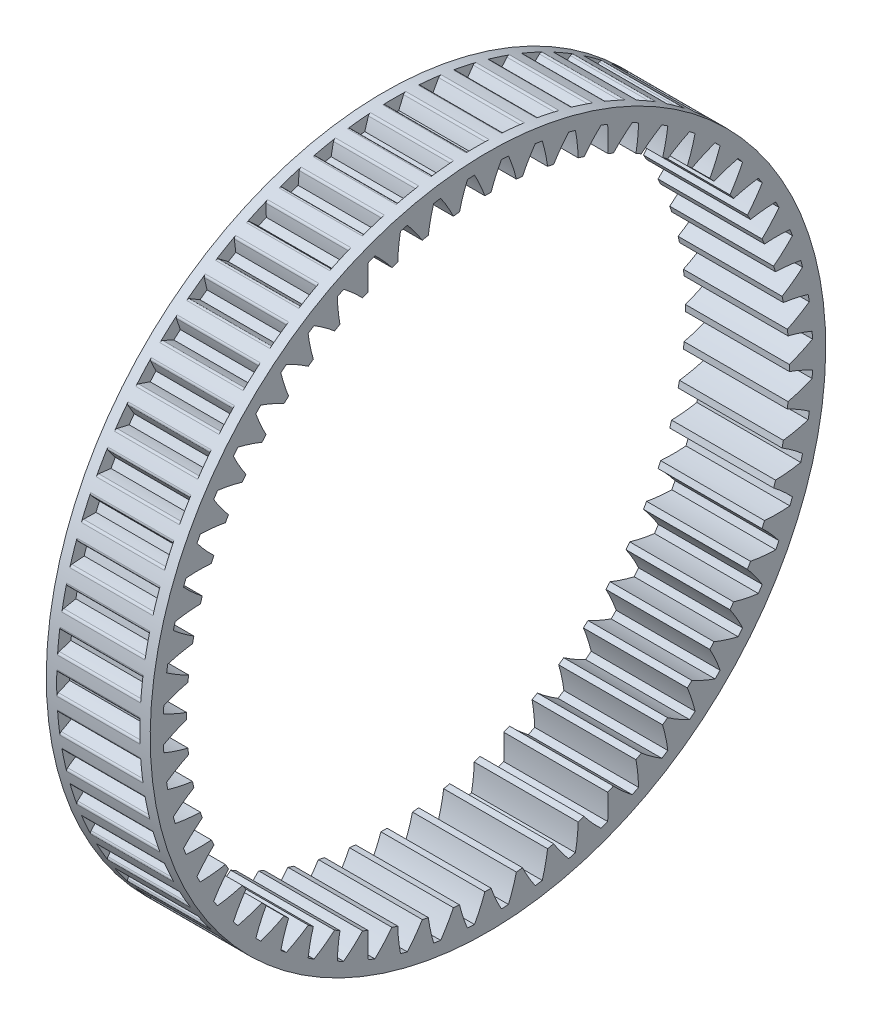
from build123d import *

# Parameters (mm, degrees)
SKETCH1_R                = 32.5
BOSS_EXTRUDE1_DEPTH      = 10
BODY_MOVE_COPY1_ANGLE    = 3
CUT_EXTRUDE1_START       = -1
CUT_EXTRUDE1_DEPTH       = 8
FILLET1_R                = 0.25
CIRPATTERN1_COUNT        = 60
FILLET1_OF_CIRPATTERN1_R = 0.25


with BuildPart() as part:
    # Sketch1 → Boss-Extrude1 (new body)
    with BuildSketch(Plane(origin=(10, 0, 0), x_dir=(0, 0, -1), z_dir=(1, 0, 0))):
        with Locations(Location((0, 0, 0), (0, 0, 180))):
            Circle(SKETCH1_R)
        with BuildLine():
            ThreePointArc((1.815562727, 28.943111996), (2.327964144, 30.050951132), (2.928742966, 31.113461165))
            ThreePointArc((2.928742966, 31.113461165), (3.266619006, 31.079803752), (3.604109412, 31.042477291))
            ThreePointArc((3.604109412, 31.042477291), (3.970851519, 29.878276711), (4.241723027, 28.688112273))
            ThreePointArc((4.241723027, 28.688112273), (4.536599486, 28.642961877), (4.830995903, 28.594780618))
            ThreePointArc((4.830995903, 28.594780618), (5.456391054, 29.642990363), (6.164941289, 30.636881367))
            ThreePointArc((6.164941289, 30.636881367), (6.49744825, 30.568090671), (6.829188171, 30.495691334))
            ThreePointArc((6.829188171, 30.495691334), (7.072229128, 29.299533377), (7.217210715, 28.087575002))
            ThreePointArc((7.217210715, 28.087575002), (7.505752308, 28.011848962), (7.793499678, 27.93315884))
            ThreePointArc((7.793499678, 27.93315884), (8.525036602, 28.910254788), (9.333595224, 29.824637486))
            ThreePointArc((9.333595224, 29.824637486), (9.657090091, 29.721467191), (9.979444915, 29.614788201))
            ThreePointArc((9.979444915, 29.614788201), (10.096121916, 28.399778225), (10.113625131, 27.179304382))
            ThreePointArc((10.113625131, 27.179304382), (10.392670537, 27.073832368), (10.670616239, 26.965495528))
            ThreePointArc((10.670616239, 26.965495528), (11.500280065, 27.860772412), (12.399988336, 28.685628636))
            ThreePointArc((12.399988336, 28.685628636), (12.710926833, 28.549209097), (13.020364772, 28.409419251))
            ThreePointArc((13.020364772, 28.409419251), (13.009399479, 27.18886916), (12.899232554, 25.973251616))
            ThreePointArc((12.899232554, 25.973251616), (13.165724492, 25.839189201), (13.430823295, 25.702392605))
            ThreePointArc((13.430823295, 25.702392605), (14.349524053, 26.506041583), (15.330524582, 27.232334036))
            ThreePointArc((15.330524582, 27.232334036), (15.6255, 27.064159894), (15.918630788, 26.892790759))
            ThreePointArc((15.918630788, 26.892790759), (15.780143338, 25.680073154), (15.543513286, 24.48263047))
            ThreePointArc((15.543513286, 24.48263047), (15.794532015, 24.32144647), (16.043879441, 24.157688889))
            ThreePointArc((16.043879441, 24.157688889), (17.041551653, 24.860905016), (18.093096392, 25.480676285))
            ThreePointArc((18.093096392, 25.480676285), (18.368876919, 25.282590091), (18.642488954, 25.081519224))
            ThreePointArc((18.642488954, 25.081519224), (18.377996645, 23.889920893), (18.017496034, 22.723772501))
            ThreePointArc((18.017496034, 22.723772501), (18.25029134, 22.537232882), (18.481155487, 22.348308479))
            ThreePointArc((18.481155487, 22.348308479), (19.546868447, 22.943387171), (20.657436452, 23.449846912))
            ThreePointArc((20.657436452, 23.449846912), (20.911000579, 23.224018941), (21.16209611, 22.995449316))
            ThreePointArc((21.16209611, 22.995449316), (20.774496775, 21.83802566), (20.294075324, 20.715948125))
            ThreePointArc((20.294075324, 20.715948125), (20.506096654, 20.506096654), (20.715948125, 20.294075324))
            ThreePointArc((20.715948125, 20.294075324), (21.83802566, 20.774496775), (22.995449316, 21.16209611))
            ThreePointArc((22.995449316, 21.16209611), (23.224018941, 20.911000579), (23.449846912, 20.657436452))
            ThreePointArc((23.449846912, 20.657436452), (22.943387171, 19.546868447), (22.348308479, 18.481155487))
            ThreePointArc((22.348308479, 18.481155487), (22.537232882, 18.25029134), (22.723772501, 18.017496034))
            ThreePointArc((22.723772501, 18.017496034), (23.889920893, 18.377996645), (25.081519224, 18.642488954))
            ThreePointArc((25.081519224, 18.642488954), (25.282590091, 18.368876919), (25.480676285, 18.093096392))
            ThreePointArc((25.480676285, 18.093096392), (24.860905016, 17.041551653), (24.157688889, 16.043879441))
            ThreePointArc((24.157688889, 16.043879441), (24.32144647, 15.794532015), (24.48263047, 15.543513286))
            ThreePointArc((24.48263047, 15.543513286), (25.680073154, 15.780143338), (26.892790759, 15.918630788))
            ThreePointArc((26.892790759, 15.918630788), (27.064159894, 15.6255), (27.232334036, 15.330524582))
            ThreePointArc((27.232334036, 15.330524582), (26.506041583, 14.349524053), (25.702392605, 13.430823295))
            ThreePointArc((25.702392605, 13.430823295), (25.839189201, 13.165724492), (25.973251616, 12.899232554))
            ThreePointArc((25.973251616, 12.899232554), (27.18886916, 13.009399479), (28.409419251, 13.020364772))
            ThreePointArc((28.409419251, 13.020364772), (28.549209097, 12.710926833), (28.685628636, 12.399988336))
            ThreePointArc((28.685628636, 12.399988336), (27.860772412, 11.500280065), (26.965495528, 10.670616239))
            ThreePointArc((26.965495528, 10.670616239), (27.073832368, 10.392670537), (27.179304382, 10.113625131))
            ThreePointArc((27.179304382, 10.113625131), (28.399778225, 10.096121916), (29.614788201, 9.979444915))
            ThreePointArc((29.614788201, 9.979444915), (29.721467191, 9.657090091), (29.824637486, 9.333595224))
            ThreePointArc((29.824637486, 9.333595224), (28.910254788, 8.525036602), (27.93315884, 7.793499678))
            ThreePointArc((27.93315884, 7.793499678), (28.011848962, 7.505752308), (28.087575002, 7.217210715))
            ThreePointArc((28.087575002, 7.217210715), (29.299533377, 7.072229128), (30.495691334, 6.829188171))
            ThreePointArc((30.495691334, 6.829188171), (30.568090671, 6.49744825), (30.636881367, 6.164941289))
            ThreePointArc((30.636881367, 6.164941289), (29.642990363, 5.456391054), (28.594780618, 4.830995903))
            ThreePointArc((28.594780618, 4.830995903), (28.642961877, 4.536599486), (28.688112273, 4.241723027))
            ThreePointArc((28.688112273, 4.241723027), (29.878276711, 3.970851519), (31.042477291, 3.604109412))
            ThreePointArc((31.042477291, 3.604109412), (31.079803752, 3.266619006), (31.113461165, 2.928742966))
            ThreePointArc((31.113461165, 2.928742966), (30.050951132, 2.327964144), (28.943111996, 1.815562727))
            ThreePointArc((28.943111996, 1.815562727), (28.960256508, 1.517742731), (28.974336581, 1.219762135))
            ThreePointArc((28.974336581, 1.219762135), (30.129667392, 0.825968429), (31.24915537, 0.339543276))
            ThreePointArc((31.24915537, 0.339543276), (31.251, 0), (31.24915537, -0.339543276))
            ThreePointArc((31.24915537, -0.339543276), (30.129667392, -0.825968429), (28.974336581, -1.219762135))
            ThreePointArc((28.974336581, -1.219762135), (28.960256508, -1.517742731), (28.943111996, -1.815562727))
            ThreePointArc((28.943111996, -1.815562727), (30.050951132, -2.327964144), (31.113461165, -2.928742966))
            ThreePointArc((31.113461165, -2.928742966), (31.079803752, -3.266619006), (31.042477291, -3.604109412))
            ThreePointArc((31.042477291, -3.604109412), (29.878276711, -3.970851519), (28.688112273, -4.241723027))
            ThreePointArc((28.688112273, -4.241723027), (28.642961877, -4.536599486), (28.594780618, -4.830995903))
            ThreePointArc((28.594780618, -4.830995903), (29.642990363, -5.456391054), (30.636881367, -6.164941289))
            ThreePointArc((30.636881367, -6.164941289), (30.568090671, -6.49744825), (30.495691334, -6.829188171))
            ThreePointArc((30.495691334, -6.829188171), (29.299533377, -7.072229128), (28.087575002, -7.217210715))
            ThreePointArc((28.087575002, -7.217210715), (28.011848962, -7.505752308), (27.93315884, -7.793499678))
            ThreePointArc((27.93315884, -7.793499678), (28.910254788, -8.525036602), (29.824637486, -9.333595224))
            ThreePointArc((29.824637486, -9.333595224), (29.721467191, -9.657090091), (29.614788201, -9.979444915))
            ThreePointArc((29.614788201, -9.979444915), (28.399778225, -10.096121916), (27.179304382, -10.113625131))
            ThreePointArc((27.179304382, -10.113625131), (27.073832368, -10.392670537), (26.965495528, -10.670616239))
            ThreePointArc((26.965495528, -10.670616239), (27.860772412, -11.500280065), (28.685628636, -12.399988336))
            ThreePointArc((28.685628636, -12.399988336), (28.549209097, -12.710926833), (28.409419251, -13.020364772))
            ThreePointArc((28.409419251, -13.020364772), (27.18886916, -13.009399479), (25.973251616, -12.899232554))
            ThreePointArc((25.973251616, -12.899232554), (25.839189201, -13.165724492), (25.702392605, -13.430823295))
            ThreePointArc((25.702392605, -13.430823295), (26.506041583, -14.349524053), (27.232334036, -15.330524582))
            ThreePointArc((27.232334036, -15.330524582), (27.064159894, -15.6255), (26.892790759, -15.918630788))
            ThreePointArc((26.892790759, -15.918630788), (25.680073154, -15.780143338), (24.48263047, -15.543513286))
            ThreePointArc((24.48263047, -15.543513286), (24.32144647, -15.794532015), (24.157688889, -16.043879441))
            ThreePointArc((24.157688889, -16.043879441), (24.860905016, -17.041551653), (25.480676285, -18.093096392))
            ThreePointArc((25.480676285, -18.093096392), (25.282590091, -18.368876919), (25.081519224, -18.642488954))
            ThreePointArc((25.081519224, -18.642488954), (23.889920893, -18.377996645), (22.723772501, -18.017496034))
            ThreePointArc((22.723772501, -18.017496034), (22.537232882, -18.25029134), (22.348308479, -18.481155487))
            ThreePointArc((22.348308479, -18.481155487), (22.943387171, -19.546868447), (23.449846912, -20.657436452))
            ThreePointArc((23.449846912, -20.657436452), (23.224018941, -20.911000579), (22.995449316, -21.16209611))
            ThreePointArc((22.995449316, -21.16209611), (21.83802566, -20.774496775), (20.715948125, -20.294075324))
            ThreePointArc((20.715948125, -20.294075324), (20.506096654, -20.506096654), (20.294075324, -20.715948125))
            ThreePointArc((20.294075324, -20.715948125), (20.774496775, -21.83802566), (21.16209611, -22.995449316))
            ThreePointArc((21.16209611, -22.995449316), (20.911000579, -23.224018941), (20.657436452, -23.449846912))
            ThreePointArc((20.657436452, -23.449846912), (19.546868447, -22.943387171), (18.481155487, -22.348308479))
            ThreePointArc((18.481155487, -22.348308479), (18.25029134, -22.537232882), (18.017496034, -22.723772501))
            ThreePointArc((18.017496034, -22.723772501), (18.377996645, -23.889920893), (18.642488954, -25.081519224))
            ThreePointArc((18.642488954, -25.081519224), (18.368876919, -25.282590091), (18.093096392, -25.480676285))
            ThreePointArc((18.093096392, -25.480676285), (17.041551653, -24.860905016), (16.043879441, -24.157688889))
            ThreePointArc((16.043879441, -24.157688889), (15.794532015, -24.32144647), (15.543513286, -24.48263047))
            ThreePointArc((15.543513286, -24.48263047), (15.780143338, -25.680073154), (15.918630788, -26.892790759))
            ThreePointArc((15.918630788, -26.892790759), (15.6255, -27.064159894), (15.330524582, -27.232334036))
            ThreePointArc((15.330524582, -27.232334036), (14.349524053, -26.506041583), (13.430823295, -25.702392605))
            ThreePointArc((13.430823295, -25.702392605), (13.165724492, -25.839189201), (12.899232554, -25.973251616))
            ThreePointArc((12.899232554, -25.973251616), (13.009399479, -27.18886916), (13.020364772, -28.409419251))
            ThreePointArc((13.020364772, -28.409419251), (12.710926833, -28.549209097), (12.399988336, -28.685628636))
            ThreePointArc((12.399988336, -28.685628636), (11.500280065, -27.860772412), (10.670616239, -26.965495528))
            ThreePointArc((10.670616239, -26.965495528), (10.392670537, -27.073832368), (10.113625131, -27.179304382))
            ThreePointArc((10.113625131, -27.179304382), (10.096121916, -28.399778225), (9.979444915, -29.614788201))
            ThreePointArc((9.979444915, -29.614788201), (9.657090091, -29.721467191), (9.333595224, -29.824637486))
            ThreePointArc((9.333595224, -29.824637486), (8.525036602, -28.910254788), (7.793499678, -27.93315884))
            ThreePointArc((7.793499678, -27.93315884), (7.505752308, -28.011848962), (7.217210715, -28.087575002))
            ThreePointArc((7.217210715, -28.087575002), (7.072229128, -29.299533377), (6.829188171, -30.495691334))
            ThreePointArc((6.829188171, -30.495691334), (6.49744825, -30.568090671), (6.164941289, -30.636881367))
            ThreePointArc((6.164941289, -30.636881367), (5.456391054, -29.642990363), (4.830995903, -28.594780618))
            ThreePointArc((4.830995903, -28.594780618), (4.536599486, -28.642961877), (4.241723027, -28.688112273))
            ThreePointArc((4.241723027, -28.688112273), (3.970851519, -29.878276711), (3.604109412, -31.042477291))
            ThreePointArc((3.604109412, -31.042477291), (3.266619006, -31.079803752), (2.928742966, -31.113461165))
            ThreePointArc((2.928742966, -31.113461165), (2.327964144, -30.050951132), (1.815562727, -28.943111996))
            ThreePointArc((1.815562727, -28.943111996), (1.517742731, -28.960256508), (1.219762135, -28.974336581))
            ThreePointArc((1.219762135, -28.974336581), (0.825968429, -30.129667392), (0.339543276, -31.24915537))
            ThreePointArc((0.339543276, -31.24915537), (0, -31.251), (-0.339543276, -31.24915537))
            ThreePointArc((-0.339543276, -31.24915537), (-0.825968429, -30.129667392), (-1.219762135, -28.974336581))
            ThreePointArc((-1.219762135, -28.974336581), (-1.517742731, -28.960256508), (-1.815562727, -28.943111996))
            ThreePointArc((-1.815562727, -28.943111996), (-2.327964144, -30.050951132), (-2.928742966, -31.113461165))
            ThreePointArc((-2.928742966, -31.113461165), (-3.266619006, -31.079803752), (-3.604109412, -31.042477291))
            ThreePointArc((-3.604109412, -31.042477291), (-3.970851519, -29.878276711), (-4.241723027, -28.688112273))
            ThreePointArc((-4.241723027, -28.688112273), (-4.536599486, -28.642961877), (-4.830995903, -28.594780618))
            ThreePointArc((-4.830995903, -28.594780618), (-5.456391054, -29.642990363), (-6.164941289, -30.636881367))
            ThreePointArc((-6.164941289, -30.636881367), (-6.49744825, -30.568090671), (-6.829188171, -30.495691334))
            ThreePointArc((-6.829188171, -30.495691334), (-7.072229128, -29.299533377), (-7.217210715, -28.087575002))
            ThreePointArc((-7.217210715, -28.087575002), (-7.505752308, -28.011848962), (-7.793499678, -27.93315884))
            ThreePointArc((-7.793499678, -27.93315884), (-8.525036602, -28.910254788), (-9.333595224, -29.824637486))
            ThreePointArc((-9.333595224, -29.824637486), (-9.657090091, -29.721467191), (-9.979444915, -29.614788201))
            ThreePointArc((-9.979444915, -29.614788201), (-10.096121916, -28.399778225), (-10.113625131, -27.179304382))
            ThreePointArc((-10.113625131, -27.179304382), (-10.392670537, -27.073832368), (-10.670616239, -26.965495528))
            ThreePointArc((-10.670616239, -26.965495528), (-11.500280065, -27.860772412), (-12.399988336, -28.685628636))
            ThreePointArc((-12.399988336, -28.685628636), (-12.710926833, -28.549209097), (-13.020364772, -28.409419251))
            ThreePointArc((-13.020364772, -28.409419251), (-13.009399479, -27.18886916), (-12.899232554, -25.973251616))
            ThreePointArc((-12.899232554, -25.973251616), (-13.165724492, -25.839189201), (-13.430823295, -25.702392605))
            ThreePointArc((-13.430823295, -25.702392605), (-14.349524053, -26.506041583), (-15.330524582, -27.232334036))
            ThreePointArc((-15.330524582, -27.232334036), (-15.6255, -27.064159894), (-15.918630788, -26.892790759))
            ThreePointArc((-15.918630788, -26.892790759), (-15.780143338, -25.680073154), (-15.543513286, -24.48263047))
            ThreePointArc((-15.543513286, -24.48263047), (-15.794532015, -24.32144647), (-16.043879441, -24.157688889))
            ThreePointArc((-16.043879441, -24.157688889), (-17.041551653, -24.860905016), (-18.093096392, -25.480676285))
            ThreePointArc((-18.093096392, -25.480676285), (-18.368876919, -25.282590091), (-18.642488954, -25.081519224))
            ThreePointArc((-18.642488954, -25.081519224), (-18.377996645, -23.889920893), (-18.017496034, -22.723772501))
            ThreePointArc((-18.017496034, -22.723772501), (-18.25029134, -22.537232882), (-18.481155487, -22.348308479))
            ThreePointArc((-18.481155487, -22.348308479), (-19.546868447, -22.943387171), (-20.657436452, -23.449846912))
            ThreePointArc((-20.657436452, -23.449846912), (-20.911000579, -23.224018941), (-21.16209611, -22.995449316))
            ThreePointArc((-21.16209611, -22.995449316), (-20.774496775, -21.83802566), (-20.294075324, -20.715948125))
            ThreePointArc((-20.294075324, -20.715948125), (-20.506096654, -20.506096654), (-20.715948125, -20.294075324))
            ThreePointArc((-20.715948125, -20.294075324), (-21.83802566, -20.774496775), (-22.995449316, -21.16209611))
            ThreePointArc((-22.995449316, -21.16209611), (-23.224018941, -20.911000579), (-23.449846912, -20.657436452))
            ThreePointArc((-23.449846912, -20.657436452), (-22.943387171, -19.546868447), (-22.348308479, -18.481155487))
            ThreePointArc((-22.348308479, -18.481155487), (-22.537232882, -18.25029134), (-22.723772501, -18.017496034))
            ThreePointArc((-22.723772501, -18.017496034), (-23.889920893, -18.377996645), (-25.081519224, -18.642488954))
            ThreePointArc((-25.081519224, -18.642488954), (-25.282590091, -18.368876919), (-25.480676285, -18.093096392))
            ThreePointArc((-25.480676285, -18.093096392), (-24.860905016, -17.041551653), (-24.157688889, -16.043879441))
            ThreePointArc((-24.157688889, -16.043879441), (-24.32144647, -15.794532015), (-24.48263047, -15.543513286))
            ThreePointArc((-24.48263047, -15.543513286), (-25.680073154, -15.780143338), (-26.892790759, -15.918630788))
            ThreePointArc((-26.892790759, -15.918630788), (-27.064159894, -15.6255), (-27.232334036, -15.330524582))
            ThreePointArc((-27.232334036, -15.330524582), (-26.506041583, -14.349524053), (-25.702392605, -13.430823295))
            ThreePointArc((-25.702392605, -13.430823295), (-25.839189201, -13.165724492), (-25.973251616, -12.899232554))
            ThreePointArc((-25.973251616, -12.899232554), (-27.18886916, -13.009399479), (-28.409419251, -13.020364772))
            ThreePointArc((-28.409419251, -13.020364772), (-28.549209097, -12.710926833), (-28.685628636, -12.399988336))
            ThreePointArc((-28.685628636, -12.399988336), (-27.860772412, -11.500280065), (-26.965495528, -10.670616239))
            ThreePointArc((-26.965495528, -10.670616239), (-27.073832368, -10.392670537), (-27.179304382, -10.113625131))
            ThreePointArc((-27.179304382, -10.113625131), (-28.399778225, -10.096121916), (-29.614788201, -9.979444915))
            ThreePointArc((-29.614788201, -9.979444915), (-29.721467191, -9.657090091), (-29.824637486, -9.333595224))
            ThreePointArc((-29.824637486, -9.333595224), (-28.910254788, -8.525036602), (-27.93315884, -7.793499678))
            ThreePointArc((-27.93315884, -7.793499678), (-28.011848962, -7.505752308), (-28.087575002, -7.217210715))
            ThreePointArc((-28.087575002, -7.217210715), (-29.299533377, -7.072229128), (-30.495691334, -6.829188171))
            ThreePointArc((-30.495691334, -6.829188171), (-30.568090671, -6.49744825), (-30.636881367, -6.164941289))
            ThreePointArc((-30.636881367, -6.164941289), (-29.642990363, -5.456391054), (-28.594780618, -4.830995903))
            ThreePointArc((-28.594780618, -4.830995903), (-28.642961877, -4.536599486), (-28.688112273, -4.241723027))
            ThreePointArc((-28.688112273, -4.241723027), (-29.878276711, -3.970851519), (-31.042477291, -3.604109412))
            ThreePointArc((-31.042477291, -3.604109412), (-31.079803752, -3.266619006), (-31.113461165, -2.928742966))
            ThreePointArc((-31.113461165, -2.928742966), (-30.050951132, -2.327964144), (-28.943111996, -1.815562727))
            ThreePointArc((-28.943111996, -1.815562727), (-28.960256508, -1.517742731), (-28.974336581, -1.219762135))
            ThreePointArc((-28.974336581, -1.219762135), (-30.129667392, -0.825968429), (-31.24915537, -0.339543276))
            ThreePointArc((-31.24915537, -0.339543276), (-31.251, 0), (-31.24915537, 0.339543276))
            ThreePointArc((-31.24915537, 0.339543276), (-30.129667392, 0.825968429), (-28.974336581, 1.219762135))
            ThreePointArc((-28.974336581, 1.219762135), (-28.960256508, 1.517742731), (-28.943111996, 1.815562727))
            ThreePointArc((-28.943111996, 1.815562727), (-30.050951132, 2.327964144), (-31.113461165, 2.928742966))
            ThreePointArc((-31.113461165, 2.928742966), (-31.079803752, 3.266619006), (-31.042477291, 3.604109412))
            ThreePointArc((-31.042477291, 3.604109412), (-29.878276711, 3.970851519), (-28.688112273, 4.241723027))
            ThreePointArc((-28.688112273, 4.241723027), (-28.642961877, 4.536599486), (-28.594780618, 4.830995903))
            ThreePointArc((-28.594780618, 4.830995903), (-29.642990363, 5.456391054), (-30.636881367, 6.164941289))
            ThreePointArc((-30.636881367, 6.164941289), (-30.568090671, 6.49744825), (-30.495691334, 6.829188171))
            ThreePointArc((-30.495691334, 6.829188171), (-29.299533377, 7.072229128), (-28.087575002, 7.217210715))
            ThreePointArc((-28.087575002, 7.217210715), (-28.011848962, 7.505752308), (-27.93315884, 7.793499678))
            ThreePointArc((-27.93315884, 7.793499678), (-28.910254788, 8.525036602), (-29.824637486, 9.333595224))
            ThreePointArc((-29.824637486, 9.333595224), (-29.721467191, 9.657090091), (-29.614788201, 9.979444915))
            ThreePointArc((-29.614788201, 9.979444915), (-28.399778225, 10.096121916), (-27.179304382, 10.113625131))
            ThreePointArc((-27.179304382, 10.113625131), (-27.073832368, 10.392670537), (-26.965495528, 10.670616239))
            ThreePointArc((-26.965495528, 10.670616239), (-27.860772412, 11.500280065), (-28.685628636, 12.399988336))
            ThreePointArc((-28.685628636, 12.399988336), (-28.549209097, 12.710926833), (-28.409419251, 13.020364772))
            ThreePointArc((-28.409419251, 13.020364772), (-27.18886916, 13.009399479), (-25.973251616, 12.899232554))
            ThreePointArc((-25.973251616, 12.899232554), (-25.839189201, 13.165724492), (-25.702392605, 13.430823295))
            ThreePointArc((-25.702392605, 13.430823295), (-26.506041583, 14.349524053), (-27.232334036, 15.330524582))
            ThreePointArc((-27.232334036, 15.330524582), (-27.064159894, 15.6255), (-26.892790759, 15.918630788))
            ThreePointArc((-26.892790759, 15.918630788), (-25.680073154, 15.780143338), (-24.48263047, 15.543513286))
            ThreePointArc((-24.48263047, 15.543513286), (-24.32144647, 15.794532015), (-24.157688889, 16.043879441))
            ThreePointArc((-24.157688889, 16.043879441), (-24.860905016, 17.041551653), (-25.480676285, 18.093096392))
            ThreePointArc((-25.480676285, 18.093096392), (-25.282590091, 18.368876919), (-25.081519224, 18.642488954))
            ThreePointArc((-25.081519224, 18.642488954), (-23.889920893, 18.377996645), (-22.723772501, 18.017496034))
            ThreePointArc((-22.723772501, 18.017496034), (-22.537232882, 18.25029134), (-22.348308479, 18.481155487))
            ThreePointArc((-22.348308479, 18.481155487), (-22.943387171, 19.546868447), (-23.449846912, 20.657436452))
            ThreePointArc((-23.449846912, 20.657436452), (-23.224018941, 20.911000579), (-22.995449316, 21.16209611))
            ThreePointArc((-22.995449316, 21.16209611), (-21.83802566, 20.774496775), (-20.715948125, 20.294075324))
            ThreePointArc((-20.715948125, 20.294075324), (-20.506096654, 20.506096654), (-20.294075324, 20.715948125))
            ThreePointArc((-20.294075324, 20.715948125), (-20.774496775, 21.83802566), (-21.16209611, 22.995449316))
            ThreePointArc((-21.16209611, 22.995449316), (-20.911000579, 23.224018941), (-20.657436452, 23.449846912))
            ThreePointArc((-20.657436452, 23.449846912), (-19.546868447, 22.943387171), (-18.481155487, 22.348308479))
            ThreePointArc((-18.481155487, 22.348308479), (-18.25029134, 22.537232882), (-18.017496034, 22.723772501))
            ThreePointArc((-18.017496034, 22.723772501), (-18.377996645, 23.889920893), (-18.642488954, 25.081519224))
            ThreePointArc((-18.642488954, 25.081519224), (-18.368876919, 25.282590091), (-18.093096392, 25.480676285))
            ThreePointArc((-18.093096392, 25.480676285), (-17.041551653, 24.860905016), (-16.043879441, 24.157688889))
            ThreePointArc((-16.043879441, 24.157688889), (-15.794532015, 24.32144647), (-15.543513286, 24.48263047))
            ThreePointArc((-15.543513286, 24.48263047), (-15.780143338, 25.680073154), (-15.918630788, 26.892790759))
            ThreePointArc((-15.918630788, 26.892790759), (-15.6255, 27.064159894), (-15.330524582, 27.232334036))
            ThreePointArc((-15.330524582, 27.232334036), (-14.349524053, 26.506041583), (-13.430823295, 25.702392605))
            ThreePointArc((-13.430823295, 25.702392605), (-13.165724492, 25.839189201), (-12.899232554, 25.973251616))
            ThreePointArc((-12.899232554, 25.973251616), (-13.009399479, 27.18886916), (-13.020364772, 28.409419251))
            ThreePointArc((-13.020364772, 28.409419251), (-12.710926833, 28.549209097), (-12.399988336, 28.685628636))
            ThreePointArc((-12.399988336, 28.685628636), (-11.500280065, 27.860772412), (-10.670616239, 26.965495528))
            ThreePointArc((-10.670616239, 26.965495528), (-10.392670537, 27.073832368), (-10.113625131, 27.179304382))
            ThreePointArc((-10.113625131, 27.179304382), (-10.096121916, 28.399778225), (-9.979444915, 29.614788201))
            ThreePointArc((-9.979444915, 29.614788201), (-9.657090091, 29.721467191), (-9.333595224, 29.824637486))
            ThreePointArc((-9.333595224, 29.824637486), (-8.525036602, 28.910254788), (-7.793499678, 27.93315884))
            ThreePointArc((-7.793499678, 27.93315884), (-7.505752308, 28.011848962), (-7.217210715, 28.087575002))
            ThreePointArc((-7.217210715, 28.087575002), (-7.072229128, 29.299533377), (-6.829188171, 30.495691334))
            ThreePointArc((-6.829188171, 30.495691334), (-6.49744825, 30.568090671), (-6.164941289, 30.636881367))
            ThreePointArc((-6.164941289, 30.636881367), (-5.456391054, 29.642990363), (-4.830995903, 28.594780618))
            ThreePointArc((-4.830995903, 28.594780618), (-4.536599486, 28.642961877), (-4.241723027, 28.688112273))
            ThreePointArc((-4.241723027, 28.688112273), (-3.970851519, 29.878276711), (-3.604109412, 31.042477291))
            ThreePointArc((-3.604109412, 31.042477291), (-3.266619006, 31.079803752), (-2.928742966, 31.113461165))
            ThreePointArc((-2.928742966, 31.113461165), (-2.327964144, 30.050951132), (-1.815562727, 28.943111996))
            ThreePointArc((-1.815562727, 28.943111996), (-1.517742731, 28.960256508), (-1.219762135, 28.974336581))
            ThreePointArc((-1.219762135, 28.974336581), (-0.825968429, 30.129667392), (-0.339543276, 31.24915537))
            ThreePointArc((-0.339543276, 31.24915537), (0, 31.251), (0.339543276, 31.24915537))
            ThreePointArc((0.339543276, 31.24915537), (0.825968429, 30.129667392), (1.219762135, 28.974336581))
            ThreePointArc((1.219762135, 28.974336581), (1.517742731, 28.960256508), (1.815562727, 28.943111996))
        make_face(mode=Mode.SUBTRACT)
    extrude(amount=-BOSS_EXTRUDE1_DEPTH)


with BuildPart() as part_1:
    # Body-Move/Copy1: moved
    add(part.part.rotate(Axis((0, 0, 0), (1, 0, 0)), BODY_MOVE_COPY1_ANGLE))

    # Sketch3 → Cut-Extrude1 (cut)
    with BuildSketch(Plane(origin=(10, 0, 0), x_dir=(0, 0, -1), z_dir=(1, 0, 0)).offset(CUT_EXTRUDE1_START)):
        with BuildLine():
            ThreePointArc((31.251914891, -0.41646206), (31.254689648, 0), (31.251914891, 0.41646206))
            add(Edge.make_bspline(
                [(31.251914891, 0.41646206), (31.264235961, 0.420959601), (31.288639279, 0.429933445), (31.345917229, 0.451136636), (31.392918291, 0.469071935), (31.45727532, 0.493723465), (31.510983923, 0.514859458), (31.570946431, 0.538650076), (31.626889452, 0.561329871), (31.685103718, 0.58520644), (31.741678358, 0.608820052), (31.799137403, 0.633131916), (31.855706159, 0.65741656), (31.912849318, 0.682322075), (31.974186137, 0.709369192), (32.050700282, 0.743736473), (32.138949308, 0.783947254), (32.244486319, 0.833460679), (32.352762741, 0.885109179), (32.469302586, 0.942580273), (32.571459207, 0.993481199), (32.695670173, 1.057690732), (32.782250465, 1.102581433), (32.892852183, 1.162109203), (32.937190992, 1.18613402), (32.96021227, 1.198710601)],
                knots=[0.068261086, 0.068261086, 0.068261086, 0.068261086, 0.068261086, 0.096158778, 0.124056507, 0.151954212, 0.179851952, 0.207749697, 0.235647455, 0.263545206, 0.291442939, 0.319340664, 0.347238382, 0.375136127, 0.403033879, 0.430931611, 0.468932632, 0.524728108, 0.580523602, 0.636319076, 0.692114552, 0.747910029, 0.80370548, 0.859500957, 0.915296464, 0.915296464, 0.915296464, 0.915296464, 0.915296464], degree=4))
            ThreePointArc((32.96021227, 1.198710601), (32.982002668, 0), (32.96021227, -1.198710601))
            add(Edge.make_bspline(
                [(31.251914891, -0.41646206), (31.264235961, -0.420959601), (31.288639279, -0.429933445), (31.345917229, -0.451136636), (31.392918291, -0.469071935), (31.45727532, -0.493723465), (31.510983923, -0.514859458), (31.570946431, -0.538650076), (31.626889452, -0.561329871), (31.685103718, -0.58520644), (31.741678358, -0.608820052), (31.799137403, -0.633131916), (31.855706159, -0.65741656), (31.912849318, -0.682322075), (31.974186137, -0.709369192), (32.050700282, -0.743736473), (32.138949308, -0.783947254), (32.244486319, -0.833460679), (32.352762741, -0.885109179), (32.469302586, -0.942580273), (32.571459207, -0.993481199), (32.695670173, -1.057690732), (32.782250465, -1.102581433), (32.892852183, -1.162109203), (32.937190992, -1.18613402), (32.96021227, -1.198710601)],
                knots=[0.068261086, 0.068261086, 0.068261086, 0.068261086, 0.068261086, 0.096158778, 0.124056507, 0.151954212, 0.179851952, 0.207749697, 0.235647455, 0.263545206, 0.291442939, 0.319340664, 0.347238382, 0.375136127, 0.403033879, 0.430931611, 0.468932632, 0.524728108, 0.580523602, 0.636319076, 0.692114552, 0.747910029, 0.80370548, 0.859500957, 0.915296464, 0.915296464, 0.915296464, 0.915296464, 0.915296464], degree=4))
        make_face()
    cut_extrude1 = extrude(amount=-CUT_EXTRUDE1_DEPTH, mode=Mode.SUBTRACT)

    # Fillet1
    fillet1_edges = [part_1.edges().sort_by_distance(p)[0] for p in [
        (5, -0.951036972, -32.486082076),
        (5, 0.951036972, -32.486082076),
    ]]
    fillet(fillet1_edges, radius=FILLET1_R)

    # CirPattern1: Cut-Extrude1 ×60 about axis
    cirpattern1_axis = Axis((0, 0, 0), (1, 0, 0))
    for i in range(1, CIRPATTERN1_COUNT):
        add(cut_extrude1.rotate(cirpattern1_axis, i * 360 / CIRPATTERN1_COUNT), mode=Mode.SUBTRACT)

    # Fillet1 of CirPattern1
    fillet1_of_cirpattern1_edges = [part_1.edges().sort_by_distance(p)[0] for p in [
        (5, 2.449893145, -32.407530353),
        (5, 4.341547329, -32.208709487),
        (5, 5.82398172, -31.973914945),
        (5, 7.684490785, -31.578451535),
        (5, 9.134261533, -31.189986634),
        (5, 10.943241352, -30.602213461),
        (5, 12.344464464, -30.064334303),
        (5, 14.082095477, -29.290691132),
        (5, 15.41941886, -28.609290834),
        (5, 17.066663216, -27.658253861),
        (5, 18.325434876, -26.840797987),
        (5, 19.864245022, -25.722786974),
        (5, 21.030673593, -24.778231741),
        (5, 22.444190003, -23.505495849),
        (5, 23.505495849, -22.444190003),
        (5, 24.778231741, -21.030673593),
        (5, 25.722786974, -19.864245022),
        (5, 26.840797987, -18.325434876),
        (5, 27.658253861, -17.066663216),
        (5, 28.609290834, -15.41941886),
        (5, 29.290691132, -14.082095477),
        (5, 30.064334303, -12.344464464),
        (5, 30.602213461, -10.943241352),
        (5, 31.189986634, -9.134261533),
        (5, 31.578451535, -7.684490785),
        (5, 31.973914945, -5.82398172),
        (5, 32.208709487, -4.341547329),
        (5, 32.407530353, -2.449893145),
        (5, 32.486082076, -0.951036972),
        (5, 32.486082076, 0.951036972),
        (5, 32.407530353, 2.449893145),
        (5, 32.208709487, 4.341547329),
        (5, 31.973914945, 5.82398172),
        (5, 31.578451535, 7.684490785),
        (5, 31.189986634, 9.134261533),
        (5, 30.602213461, 10.943241352),
        (5, 30.064334303, 12.344464464),
        (5, 29.290691132, 14.082095477),
        (5, 28.609290834, 15.41941886),
        (5, 27.658253861, 17.066663216),
        (5, 26.840797987, 18.325434876),
        (5, 25.722786974, 19.864245022),
        (5, 24.778231741, 21.030673593),
        (5, 23.505495849, 22.444190003),
        (5, 22.444190003, 23.505495849),
        (5, 21.030673593, 24.778231741),
        (5, 19.864245022, 25.722786974),
        (5, 18.325434876, 26.840797987),
        (5, 17.066663216, 27.658253861),
        (5, 15.41941886, 28.609290834),
        (5, 14.082095477, 29.290691132),
        (5, 12.344464464, 30.064334303),
        (5, 10.943241352, 30.602213461),
        (5, 9.134261533, 31.189986634),
        (5, 7.684490785, 31.578451535),
        (5, 5.82398172, 31.973914945),
        (5, 4.341547329, 32.208709487),
        (5, 2.449893145, 32.407530353),
        (5, 0.951036972, 32.486082076),
        (5, -0.951036972, 32.486082076),
        (5, -2.449893145, 32.407530353),
        (5, -4.341547329, 32.208709487),
        (5, -5.82398172, 31.973914945),
        (5, -7.684490785, 31.578451535),
        (5, -9.134261533, 31.189986634),
        (5, -10.943241352, 30.602213461),
        (5, -12.344464464, 30.064334303),
        (5, -14.082095477, 29.290691132),
        (5, -15.41941886, 28.609290834),
        (5, -17.066663216, 27.658253861),
        (5, -18.325434876, 26.840797987),
        (5, -19.864245022, 25.722786974),
        (5, -21.030673593, 24.778231741),
        (5, -22.444190003, 23.505495849),
        (5, -23.505495849, 22.444190003),
        (5, -24.778231741, 21.030673593),
        (5, -25.722786974, 19.864245022),
        (5, -26.840797987, 18.325434876),
        (5, -27.658253861, 17.066663216),
        (5, -28.609290834, 15.41941886),
        (5, -29.290691132, 14.082095477),
        (5, -30.064334303, 12.344464464),
        (5, -30.602213461, 10.943241352),
        (5, -31.189986634, 9.134261533),
        (5, -31.578451535, 7.684490785),
        (5, -31.973914945, 5.82398172),
        (5, -32.208709487, 4.341547329),
        (5, -32.407530353, 2.449893145),
        (5, -32.486082076, 0.951036972),
        (5, -32.486082076, -0.951036972),
        (5, -32.407530353, -2.449893145),
        (5, -32.208709487, -4.341547329),
        (5, -31.973914945, -5.82398172),
        (5, -31.578451535, -7.684490785),
        (5, -31.189986634, -9.134261533),
        (5, -30.602213461, -10.943241352),
        (5, -30.064334303, -12.344464464),
        (5, -29.290691132, -14.082095477),
        (5, -28.609290834, -15.41941886),
        (5, -27.658253861, -17.066663216),
        (5, -26.840797987, -18.325434876),
        (5, -25.722786974, -19.864245022),
        (5, -24.778231741, -21.030673593),
        (5, -23.505495849, -22.444190003),
        (5, -22.444190003, -23.505495849),
        (5, -21.030673593, -24.778231741),
        (5, -19.864245022, -25.722786974),
        (5, -18.325434876, -26.840797987),
        (5, -17.066663216, -27.658253861),
        (5, -15.41941886, -28.609290834),
        (5, -14.082095477, -29.290691132),
        (5, -12.344464464, -30.064334303),
        (5, -10.943241352, -30.602213461),
        (5, -9.134261533, -31.189986634),
        (5, -7.684490785, -31.578451535),
        (5, -5.82398172, -31.973914945),
        (5, -4.341547329, -32.208709487),
        (5, -2.449893145, -32.407530353),
    ]]
    fillet(fillet1_of_cirpattern1_edges, radius=FILLET1_OF_CIRPATTERN1_R)


solid = part_1.part
